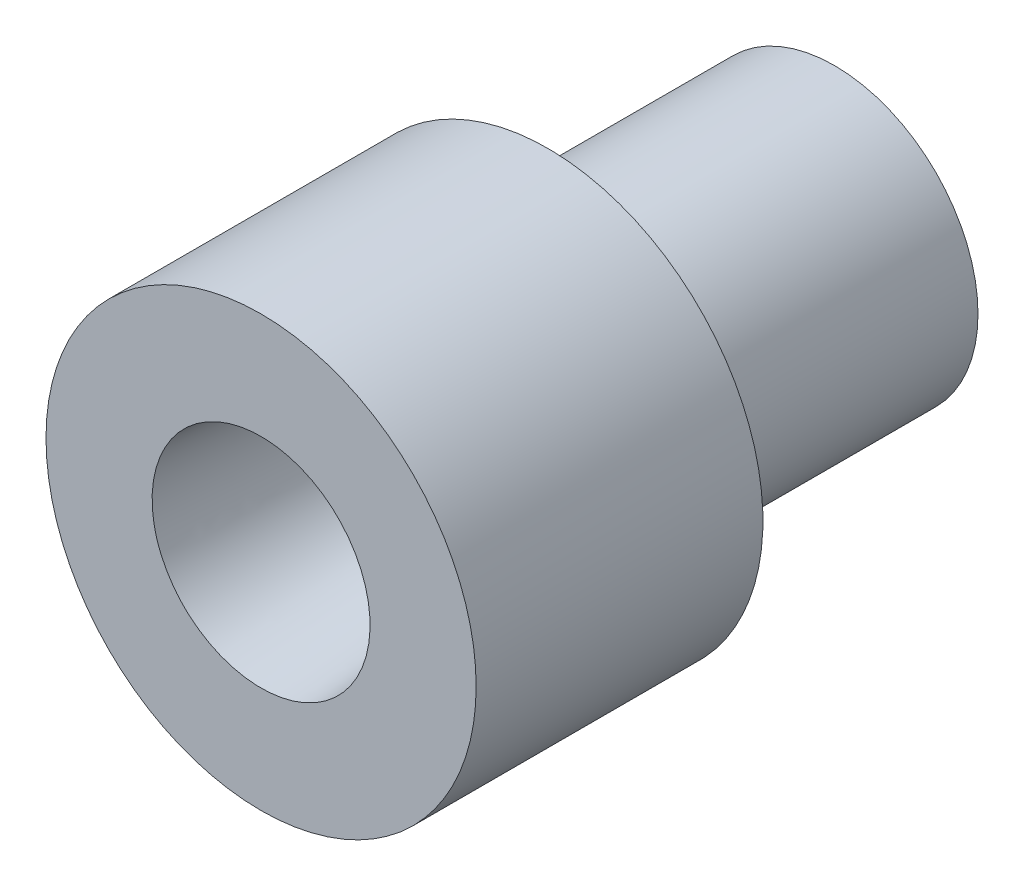
from build123d import *

# Parameters (mm, degrees)
SKETCH1_R           = 9.525
BOSS_EXTRUDE1_DEPTH = 25.4
SKETCH4_R           = 9.525
SKETCH4_R_2         = 6.35
CUT_EXTRUDE1_DEPTH  = 12.7


with BuildPart() as part:
    # Sketch1 → Boss-Extrude1 (new body)
    with BuildSketch(Plane.XY):
        Circle(SKETCH1_R)
    extrude(amount=BOSS_EXTRUDE1_DEPTH)

    # Cut-Loft1: read off the stored shape, not the designer's step
    # Cut-Loft1: loft between two sections, ruled curve by curve
    cut_loft1_from = [
        Edge.make_bspline([(4.189007655, 2.396349487, 25.4), (8.981706629, -5.981665824, 25.4), (0.603691318, -10.774364798, 25.4), (-4.189007655, -2.396349487, 25.4), (-8.981706629, 5.981665824, 25.4), (-0.603691318, 10.774364798, 25.4), (4.189007655, 2.396349487, 25.4)], [0, 0, 0, 0, 0.5, 0.5, 0.5, 1, 1, 1, 1], 3, [1, 0.333333333, 0.333333333, 1, 0.333333333, 0.333333333, 1]),
    ]
    cut_loft1_to = [
        Edge.make_bspline([(2.245993729, 0.791115497, 0), (3.828224724, -3.700871962, 0), (-0.663762735, -5.283102956, 0), (-2.245993729, -0.791115497, 0), (-3.828224724, 3.700871962, 0), (0.663762735, 5.283102956, 0), (2.245993729, 0.791115497, 0)], [0, 0, 0, 0, 0.5, 0.5, 0.5, 1, 1, 1, 1], 3, [1, 0.333333333, 0.333333333, 1, 0.333333333, 0.333333333, 1]),
    ]
    cut_loft1 = Solid(Shell([*[Face.make_surface_from_curves(cut_loft1_from[k], cut_loft1_to[k]) for k in range(1)], Face(Wire(cut_loft1_from)), Face(Wire(cut_loft1_to))]))
    add(cut_loft1, mode=Mode.SUBTRACT)

    # Sketch4 → Cut-Extrude1 (cut)
    with BuildSketch(Plane(origin=(0, 0, 0), x_dir=(-1, 0, 0), z_dir=(0, 0, -1))):
        Circle(SKETCH4_R)
        Circle(SKETCH4_R_2, mode=Mode.SUBTRACT)
    extrude(amount=-CUT_EXTRUDE1_DEPTH, mode=Mode.SUBTRACT)


solid = part.part
